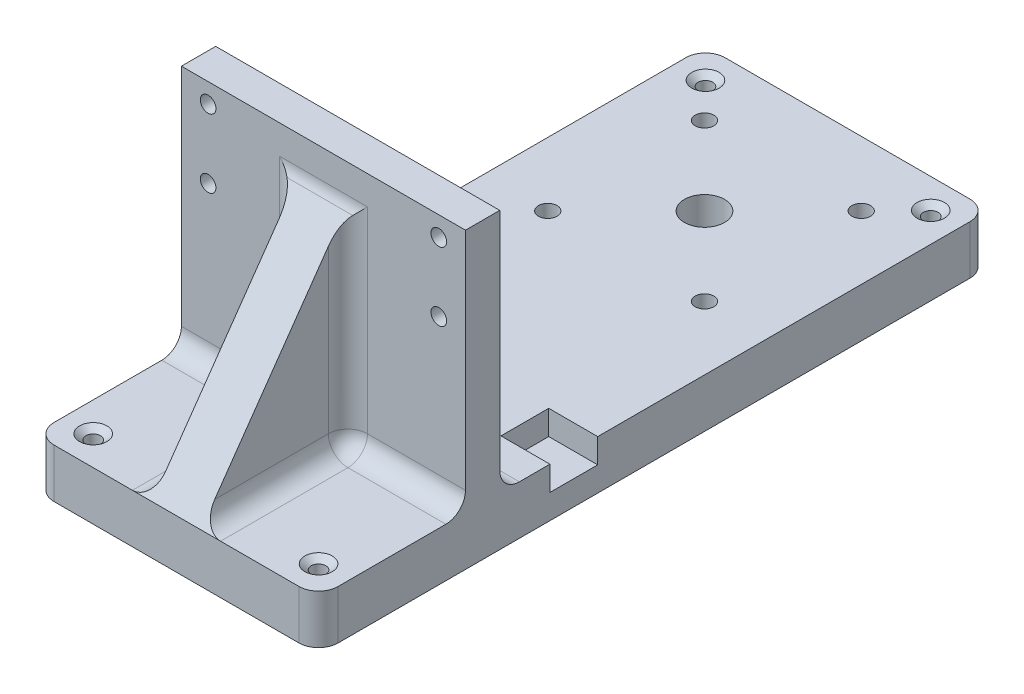
from build123d import *

# Parameters (mm, degrees)
SKETCH1_W                                         = 73.66
SKETCH1_H                                         = 69.85
BOSS_EXTRUDE1_DEPTH                               = 8.89
SKETCH2_R                                         = 2.032
CUT_EXTRUDE1_DEPTH                                = 8.89
SKETCH3_W                                         = 73.66
SKETCH3_H                                         = 12.7
BOSS_EXTRUDE2_DEPTH                               = 127
BOSS_EXTRUDE3_DEPTH                               = 38.1
BOSS_EXTRUDE3_DEPTH_BACK                          = 135.89
SKETCH4_W                                         = 73.66
SKETCH4_H                                         = 12.7
BOSS_EXTRUDE4_START                               = -36.83
BOSS_EXTRUDE4_DEPTH                               = 6.35
SKETCH7_R                                         = 2.667
SKETCH7_R_2                                       = 5.207
SKETCH7_R_3                                       = 2.413
CUT_EXTRUDE2_DEPTH                                = 12.7
SKETCH27_W                                        = 12.3952
SKETCH27_H                                        = 6.35
CUT_EXTRUDE3_DEPTH                                = 12.7
SKETCH28_W                                        = 12.3952
SKETCH28_H                                        = 6.35
CUT_EXTRUDE4_DEPTH                                = 12.7
CSK_FOR_6_FLAT_HEAD_MACHINE_SCREW_100_D           = 3.7973
CSK_FOR_6_FLAT_HEAD_MACHINE_SCREW_100_CSINK_D     = 7.0866
CSK_FOR_6_FLAT_HEAD_MACHINE_SCREW_100_CSINK_ANGLE = 100
FILLET1_R                                         = 5.08
SKETCH35_R                                        = 5.08
CUT_EXTRUDE5_DEPTH                                = 6.35


with BuildPart() as part:
    # Sketch1 → Boss-Extrude1 (new body)
    with BuildSketch(Plane.XY):
        Rectangle(SKETCH1_W, SKETCH1_H)
    extrude(amount=BOSS_EXTRUDE1_DEPTH)

    # Sketch2 → Cut-Extrude1 (cut)
    with BuildSketch(Plane(origin=(0, 0, 0), x_dir=(-1, 0, 0), z_dir=(0, 0, -1))):
        with Locations((-29.9085, 29.845)):
            Circle(SKETCH2_R)
        with Locations((-29.9085, 12.065)):
            Circle(SKETCH2_R)
        with Locations(Location((29.9085, 12.065, 0), (0, 0, 180))):
            Circle(SKETCH2_R)
        with Locations(Location((29.9085, 29.845, 0), (0, 0, 180))):
            Circle(SKETCH2_R)
    extrude(amount=-CUT_EXTRUDE1_DEPTH, mode=Mode.SUBTRACT)

    # Sketch3 → Boss-Extrude2 (add)
    with BuildSketch(Plane(origin=(0, 0, 0), x_dir=(-1, 0, 0), z_dir=(0, 0, -1))):
        with Locations((0, -34.925)):
            Rectangle(SKETCH3_W, SKETCH3_H)
    extrude(amount=BOSS_EXTRUDE2_DEPTH)

    # Sketch4 → Boss-Extrude3 (add, two sides: drawn at the far end of the back side and taken through both)
    with BuildSketch(Plane.XY.offset(8.89).offset(-BOSS_EXTRUDE3_DEPTH_BACK)):
        with Locations((0, -34.925)):
            Rectangle(SKETCH4_W, SKETCH4_H)
    extrude(amount=BOSS_EXTRUDE3_DEPTH + BOSS_EXTRUDE3_DEPTH_BACK)

    # Sketch5 → Boss-Extrude4 (add, symmetric)
    with BuildSketch(Plane(origin=(36.83, 0, 0), x_dir=(0, 0, -1), z_dir=(1, 0, 0)).offset(BOSS_EXTRUDE4_START)):
        Polygon((-46.99, -28.575), (-8.89, 25.837439057), (-8.89, -28.575), align=None)
    extrude(amount=BOSS_EXTRUDE4_DEPTH, both=True)

    # Sketch7 → Cut-Extrude2 (cut)
    with BuildSketch(Plane(origin=(0, -28.575, 0), x_dir=(1, 0, 0), z_dir=(0, 1, 0))):
        with Locations(Location((0, 26.416, 0), (0, 0, 270))):
            Circle(SKETCH7_R)
        with Locations(Location((0, 89.916, 0), (0, 0, 270))):
            Circle(SKETCH7_R_2)
        with Locations(Location((-20.32, 69.596, 0), (0, 0, 270))):
            Circle(SKETCH7_R_3)
        with Locations(Location((20.32, 69.596, 0), (0, 0, 270))):
            Circle(SKETCH7_R_3)
        with Locations(Location((20.32, 110.236, 0), (0, 0, 270))):
            Circle(SKETCH7_R_3)
        with Locations(Location((-20.32, 110.236, 0), (0, 0, 270))):
            Circle(SKETCH7_R_3)
    extrude(amount=-CUT_EXTRUDE2_DEPTH, mode=Mode.SUBTRACT)

    # Sketch27 → Cut-Extrude3 (cut)
    with BuildSketch(Plane.ZY.offset(36.83)):
        with Locations((-19.2024, -31.75)):
            Rectangle(SKETCH27_W, SKETCH27_H)
    extrude(amount=-CUT_EXTRUDE3_DEPTH, mode=Mode.SUBTRACT)

    # Sketch28 → Cut-Extrude4 (cut)
    with BuildSketch(Plane(origin=(36.83, 0, 0), x_dir=(0, 0, -1), z_dir=(1, 0, 0))):
        with Locations((19.2024, -31.75)):
            Rectangle(SKETCH28_W, SKETCH28_H)
    extrude(amount=-CUT_EXTRUDE4_DEPTH, mode=Mode.SUBTRACT)

    # CSK for #6 Flat Head Machine Screw (100)1 (through all)
    with Locations(Plane(origin=(0, -28.575, 0), x_dir=(1, 0, 0), z_dir=(0, 1, 0))):
        with Locations((-29.21, -39.37), (29.21, -39.37), (29.21, 119.38), (-29.21, 119.38)):
            CounterSinkHole(CSK_FOR_6_FLAT_HEAD_MACHINE_SCREW_100_D / 2, CSK_FOR_6_FLAT_HEAD_MACHINE_SCREW_100_CSINK_D / 2, counter_sink_angle=CSK_FOR_6_FLAT_HEAD_MACHINE_SCREW_100_CSINK_ANGLE)

    # Fillet1
    fillet1_edges = [part.edges().sort_by_distance(p)[0] for p in [
        (0, -28.575, 0),
    ]]
    fillet(fillet1_edges, radius=FILLET1_R)
    fillet1_2_edges = [part.edges().sort_by_distance(p)[0] for p in [
        (-6.35, -1.368780472, 8.89),
    ]]
    fillet(fillet1_2_edges, radius=FILLET1_R)
    fillet1_3_edges = [part.edges().sort_by_distance(p)[0] for p in [
        (6.35, -1.368780472, 8.89),
    ]]
    fillet(fillet1_3_edges, radius=FILLET1_R)
    fillet1_4_edges = [part.edges().sort_by_distance(p)[0] for p in [
        (0, 25.837439057, 8.89),
    ]]
    fillet(fillet1_4_edges, radius=FILLET1_R)
    fillet1_5_edges = [part.edges().sort_by_distance(p)[0] for p in [
        (36.83, -34.925, -127),
    ]]
    fillet(fillet1_5_edges, radius=FILLET1_R)
    fillet1_6_edges = [part.edges().sort_by_distance(p)[0] for p in [
        (36.83, -34.925, 46.99),
    ]]
    fillet(fillet1_6_edges, radius=FILLET1_R)
    fillet1_7_edges = [part.edges().sort_by_distance(p)[0] for p in [
        (-36.83, -34.925, 46.99),
    ]]
    fillet(fillet1_7_edges, radius=FILLET1_R)
    fillet1_8_edges = [part.edges().sort_by_distance(p)[0] for p in [
        (-36.83, -34.925, -127),
    ]]
    fillet(fillet1_8_edges, radius=FILLET1_R)
    # the kernel refuses this fillet: 5.08 mm, written as the material it adds along each edge
    with BuildSketch(Plane(origin=(6.35, -28.575, 13.97), x_dir=(1, 0, 0), z_dir=(0, 0, 1))) as fillet1_9_piece_1_section:
        with BuildLine():
            CenterArc((FILLET1_R, FILLET1_R), FILLET1_R, 180, 90)
            Line((0, FILLET1_R), (-FILLET1_R * 0.02, FILLET1_R))
            Line((-FILLET1_R * 0.02, FILLET1_R), (-FILLET1_R * 0.02, -FILLET1_R * 0.02))
            Line((-FILLET1_R * 0.02, -FILLET1_R * 0.02), (FILLET1_R, -FILLET1_R * 0.02))
            Line((FILLET1_R, -FILLET1_R * 0.02), (FILLET1_R, 0))
        make_face()
    fillet1_9_piece_1 = extrude(amount=33.02, mode=Mode.PRIVATE)
    fillet1_9_piece_1 = split(fillet1_9_piece_1, bisect_by=Plane(origin=(7.515371232, -19.877941852, 40.900254324), z_dir=(0, -0.5735764363510472, -0.8191520442889911)), keep=Keep.TOP, mode=Mode.PRIVATE)
    add(fillet1_9_piece_1)
    with BuildSketch(Plane(origin=(11.43, -28.575, 13.97), x_dir=(0, 0, -1), z_dir=(1, 0, 0))) as fillet1_9_piece_2:
        with BuildLine():
            CenterArc((5.08 - FILLET1_R, FILLET1_R), FILLET1_R, 270, 90)
            Line((5.08, FILLET1_R), (5.08 + FILLET1_R * 0.02, FILLET1_R))
            Line((5.08 + FILLET1_R * 0.02, FILLET1_R), (5.08 + FILLET1_R * 0.02, 0))
            Line((5.08 + FILLET1_R * 0.02, 0), (5.08, -FILLET1_R * 0.02))
            Line((5.08, -FILLET1_R * 0.02), (5.08 - FILLET1_R, -FILLET1_R * 0.02))
            Line((5.08 - FILLET1_R, -FILLET1_R * 0.02), (5.08 - FILLET1_R, 0))
        make_face()
    revolve(axis=Axis((11.43, -28.575, 13.97), (0, 1, 0)), revolution_arc=90)
    with BuildSketch(Plane(origin=(11.43, -28.575, 8.89), x_dir=(0, 1, 0), z_dir=(1, 0, 0))) as fillet1_9_piece_3:
        with BuildLine():
            CenterArc((FILLET1_R, FILLET1_R), FILLET1_R, 180, 90)
            Line((0, FILLET1_R), (-FILLET1_R * 0.02, FILLET1_R))
            Line((-FILLET1_R * 0.02, FILLET1_R), (-FILLET1_R * 0.02, -FILLET1_R * 0.02))
            Line((-FILLET1_R * 0.02, -FILLET1_R * 0.02), (FILLET1_R, -FILLET1_R * 0.02))
            Line((FILLET1_R, -FILLET1_R * 0.02), (FILLET1_R, 0))
        make_face()
    extrude(amount=25.4)
    # the kernel refuses this fillet: 5.08 mm, written as the material it adds along each edge
    with BuildSketch(Plane(origin=(-6.35, -28.575, 13.97), x_dir=(-1, 0, 0), z_dir=(0, 0, 1))) as fillet1_10_piece_1_section:
        with BuildLine():
            CenterArc((FILLET1_R, -FILLET1_R), FILLET1_R, 90, 90)
            Line((0, -FILLET1_R), (-FILLET1_R * 0.02, -FILLET1_R))
            Line((-FILLET1_R * 0.02, -FILLET1_R), (-FILLET1_R * 0.02, FILLET1_R * 0.02))
            Line((-FILLET1_R * 0.02, FILLET1_R * 0.02), (FILLET1_R, FILLET1_R * 0.02))
            Line((FILLET1_R, FILLET1_R * 0.02), (FILLET1_R, 0))
        make_face()
    fillet1_10_piece_1 = extrude(amount=33.02, mode=Mode.PRIVATE)
    fillet1_10_piece_1 = split(fillet1_10_piece_1, bisect_by=Plane(origin=(-7.515371232, -19.877941852, 40.900254324), z_dir=(0, -0.5735764363510472, -0.8191520442889911)), keep=Keep.TOP, mode=Mode.PRIVATE)
    add(fillet1_10_piece_1)
    with BuildSketch(Plane(origin=(-11.43, -28.575, 13.97), x_dir=(0, 0, -1), z_dir=(-1, 0, 0))) as fillet1_10_piece_2:
        with BuildLine():
            CenterArc((5.08 - FILLET1_R, -FILLET1_R), FILLET1_R, 0, 90)
            Line((5.08, -FILLET1_R), (5.08 + FILLET1_R * 0.02, -FILLET1_R))
            Line((5.08 + FILLET1_R * 0.02, -FILLET1_R), (5.08 + FILLET1_R * 0.02, 0))
            Line((5.08 + FILLET1_R * 0.02, 0), (5.08, FILLET1_R * 0.02))
            Line((5.08, FILLET1_R * 0.02), (5.08 - FILLET1_R, FILLET1_R * 0.02))
            Line((5.08 - FILLET1_R, FILLET1_R * 0.02), (5.08 - FILLET1_R, 0))
        make_face()
    revolve(axis=Axis((-11.43, -28.575, 13.97), (0, -1, 0)), revolution_arc=90)
    with BuildSketch(Plane(origin=(-36.83, -28.575, 8.89), x_dir=(0, 0, 1), z_dir=(1, 0, 0))) as fillet1_10_piece_3:
        with BuildLine():
            CenterArc((FILLET1_R, -FILLET1_R), FILLET1_R, 90, 90)
            Line((0, -FILLET1_R), (-FILLET1_R * 0.02, -FILLET1_R))
            Line((-FILLET1_R * 0.02, -FILLET1_R), (-FILLET1_R * 0.02, FILLET1_R * 0.02))
            Line((-FILLET1_R * 0.02, FILLET1_R * 0.02), (FILLET1_R, FILLET1_R * 0.02))
            Line((FILLET1_R, FILLET1_R * 0.02), (FILLET1_R, 0))
        make_face()
    extrude(amount=25.4)

    # Sketch35 → Cut-Extrude5 (cut)
    with BuildSketch(Plane.XZ.offset(41.275)):
        with Locations((20.32, -110.236)):
            Circle(SKETCH35_R)
        with Locations((-20.32, -110.236)):
            Circle(SKETCH35_R)
        with Locations((-20.32, -69.596)):
            Circle(SKETCH35_R)
        with Locations((20.32, -69.596)):
            Circle(SKETCH35_R)
    extrude(amount=-CUT_EXTRUDE5_DEPTH, mode=Mode.SUBTRACT)


solid = part.part
